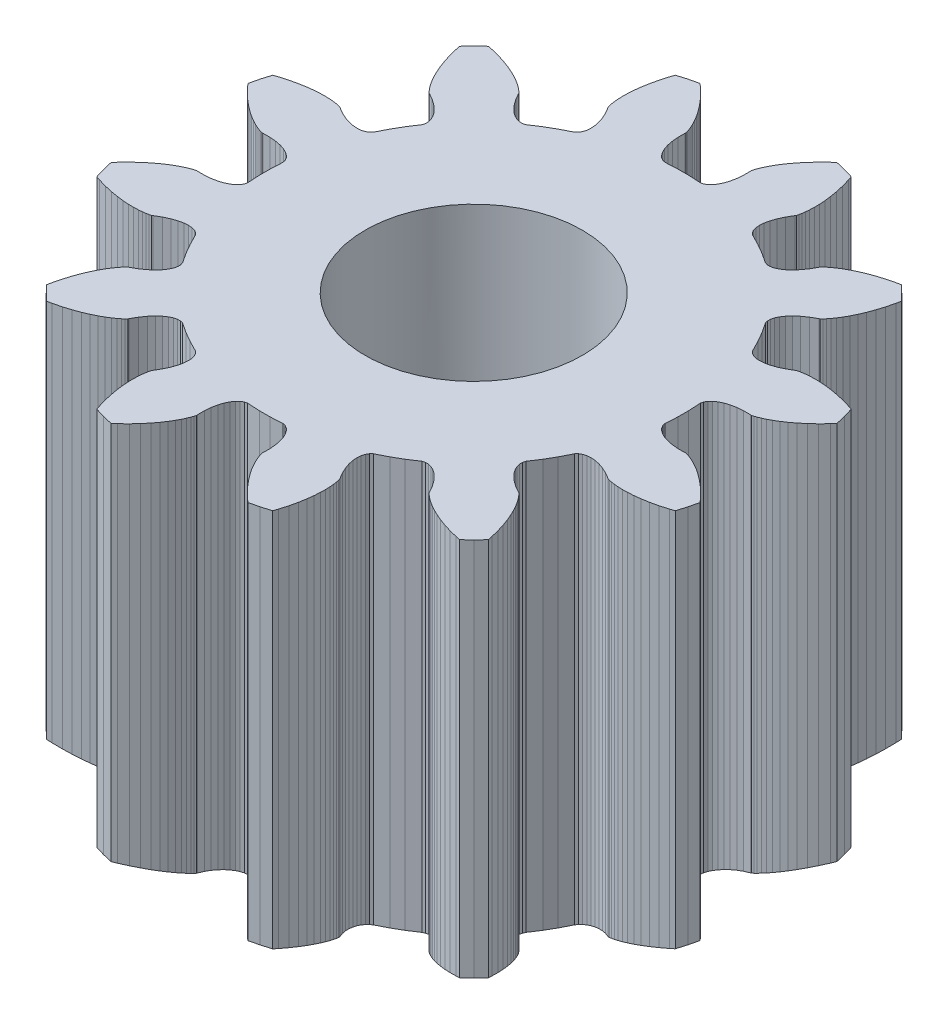
from build123d import *

# Parameters (mm, degrees)
BOSS_EXTRUDE3_DEPTH = 13
SKETCH5_R           = 3.2
CUT_EXTRUDE2_DEPTH  = 18.880490309
BOSS_EXTRUDE4_DEPTH = 6.5


with BuildPart() as part:
    # Sketch4 → Boss-Extrude3 (new body)
    with BuildSketch(Plane(origin=(0, 0, 0), x_dir=(1, 0, 0), z_dir=(0, 1, 0))):
        Polygon((-8.514154269, 2.591520468), (-8.600532227, 2.306770502), (-8.668101704, 2.016980819), (-8.582535159, 1.918957192), (-8.406382101, 1.73729734), (-8.235487485, 1.578593831), (-8.071731561, 1.441761367), (-7.916893513, 1.325582897), (-7.772642932, 1.228717315), (-7.640531833, 1.149707686), (-7.521987223, 1.086989958), (-7.418304279, 1.038902136), (-7.33064013, 1.003693857), (-7.260008302, 0.979536349), (-7.207273811, 0.964532721), (-7.20104707, 0.963108698), (-7.17128186, 0.965774744), (-6.967550359, 0.966777275), (-6.783785979, 0.950125513), (-6.621224107, 0.917931364), (-6.480932873, 0.872384795), (-6.363808518, 0.815742074), (-6.270571529, 0.750313743), (-6.201763575, 0.678452376), (-6.157745236, 0.602540177), (-6.138694542, 0.524976457), (-6.157745236, 0.16146757), (-6.157745236, -0.16146757), (-6.138694542, -0.524976457), (-6.157745236, -0.602540177), (-6.201763575, -0.678452376), (-6.270571529, -0.750313743), (-6.363808518, -0.815742074), (-6.480932873, -0.872384795), (-6.621224107, -0.917931364), (-6.783785979, -0.950125513), (-6.967550359, -0.966777275), (-7.17128186, -0.965774744), (-7.20104707, -0.963108698), (-7.207273811, -0.964532721), (-7.260008302, -0.979536349), (-7.33064013, -1.003693857), (-7.418304279, -1.038902136), (-7.521987223, -1.086989958), (-7.640531833, -1.149707686), (-7.772642932, -1.228717315), (-7.916893513, -1.325582897), (-8.071731561, -1.441761367), (-8.235487485, -1.578593831), (-8.406382101, -1.73729734), (-8.582535159, -1.918957192), (-8.668101704, -2.016980819), (-8.600532227, -2.306770502), (-8.514154269, -2.591520468), (-8.391039654, -2.633628146), (-8.147656705, -2.702873665), (-7.920305872, -2.754867627), (-7.71007285, -2.791490054), (-7.517889931, -2.814684536), (-7.344532473, -2.826447301), (-7.19061609, -2.828816098), (-7.056594583, -2.823858938), (-6.942758608, -2.813662741), (-6.849235089, -2.800321931), (-6.775987377, -2.785927033), (-6.722816154, -2.77255331), (-6.716711627, -2.77067318), (-6.692267222, -2.753481712), (-6.516331832, -2.650747744), (-6.348861329, -2.573286402), (-6.191981544, -2.519886417), (-6.047712487, -2.489185286), (-5.917958459, -2.479677144), (-5.804498693, -2.489721246), (-5.708978573, -2.517551038), (-5.632901474, -2.561283762), (-5.577621229, -2.618930567), (-5.41236517, -2.943263844), (-5.2508976, -3.222933879), (-5.052644772, -3.528216463), (-5.030361297, -3.604913962), (-5.030526197, -3.692665025), (-5.05418495, -3.789302771), (-5.102216385, -3.892583862), (-5.175327692, -4.000200075), (-5.27405018, -4.109790178), (-5.398735816, -4.218952065), (-5.549554557, -4.325255103), (-5.726492478, -4.426252636), (-5.753602929, -4.438826378), (-5.758283433, -4.443172989), (-5.796451028, -4.482533757), (-5.845541232, -4.538770687), (-5.903856472, -4.613094026), (-5.969604625, -4.706580773), (-6.040908404, -4.820168223), (-6.115815158, -4.954648119), (-6.192307034, -5.110661465), (-6.268311482, -5.288693995), (-6.341712041, -5.489072346), (-6.410359365, -5.711960925), (-6.472082461, -5.957359501), (-6.49717345, -6.085033725), (-6.293761725, -6.302214213), (-6.076581237, -6.505625938), (-5.948907013, -6.480534949), (-5.703508437, -6.418811853), (-5.480619858, -6.350164529), (-5.280241507, -6.276763971), (-5.102208976, -6.200759522), (-4.946195631, -6.124267646), (-4.811715735, -6.049360892), (-4.698128285, -5.978057113), (-4.604641537, -5.91230896), (-4.530318199, -5.85399372), (-4.474081269, -5.804903516), (-4.434720501, -5.766735921), (-4.43037389, -5.762055417), (-4.417800148, -5.734944966), (-4.316802615, -5.558007045), (-4.210499577, -5.407188304), (-4.10133769, -5.282502668), (-3.991747587, -5.18378018), (-3.884131374, -5.110668874), (-3.780850283, -5.062637438), (-3.684212536, -5.038978685), (-3.596461474, -5.038813785), (-3.519763975, -5.06109726), (-3.214481391, -5.259350088), (-2.934811356, -5.420817658), (-2.610478079, -5.586073717), (-2.552831274, -5.641353962), (-2.50909855, -5.717431062), (-2.481268758, -5.812951181), (-2.471224656, -5.926410948), (-2.480732798, -6.056164975), (-2.511433929, -6.200434032), (-2.564833914, -6.357313818), (-2.642295256, -6.52478432), (-2.745029224, -6.70071971), (-2.762220692, -6.725164115), (-2.764100822, -6.731268642), (-2.777474545, -6.784439865), (-2.791869443, -6.857687577), (-2.805210253, -6.951211096), (-2.81540645, -7.065047071), (-2.82036361, -7.199068578), (-2.817994813, -7.352984961), (-2.806232048, -7.526342419), (-2.783037566, -7.718525338), (-2.746415139, -7.92875836), (-2.694421177, -8.156109193), (-2.625175658, -8.399492142), (-2.583067979, -8.522606758), (-2.298318014, -8.608984715), (-2.008528331, -8.676554192), (-1.910504704, -8.590987647), (-1.728844851, -8.41483459), (-1.570141343, -8.243939974), (-1.433308879, -8.08018405), (-1.317130409, -7.925346001), (-1.220264827, -7.781095421), (-1.141255197, -7.648984321), (-1.07853747, -7.530439712), (-1.030449648, -7.426756767), (-0.995241369, -7.339092618), (-0.971083861, -7.26846079), (-0.956080233, -7.215726299), (-0.954656209, -7.209499558), (-0.957322255, -7.179734348), (-0.958324787, -6.976002847), (-0.941673025, -6.792238467), (-0.909478876, -6.629676595), (-0.863932307, -6.489385361), (-0.807289586, -6.372261006), (-0.741861255, -6.279024017), (-0.669999888, -6.210216063), (-0.594087689, -6.166197724), (-0.516523969, -6.14714703), (-0.153015082, -6.166197724), (0.169920058, -6.166197724), (0.533428945, -6.14714703), (0.610992665, -6.166197724), (0.686904864, -6.210216063), (0.758766231, -6.279024017), (0.824194562, -6.372261006), (0.880837283, -6.489385361), (0.926383852, -6.629676595), (0.958578002, -6.792238467), (0.975229763, -6.976002847), (0.974227232, -7.179734348), (0.971561186, -7.209499558), (0.972985209, -7.215726299), (0.987988837, -7.26846079), (1.012146345, -7.339092618), (1.047354625, -7.426756767), (1.095442446, -7.530439712), (1.158160174, -7.648984321), (1.237169803, -7.781095421), (1.334035386, -7.925346001), (1.450213855, -8.08018405), (1.587046319, -8.243939974), (1.745749828, -8.41483459), (1.92740968, -8.590987647), (2.025433308, -8.676554192), (2.31522299, -8.608984715), (2.599972956, -8.522606758), (2.642080634, -8.399492142), (2.711326153, -8.156109193), (2.763320115, -7.92875836), (2.799942543, -7.718525338), (2.823137025, -7.526342419), (2.834899789, -7.352984961), (2.837268586, -7.199068578), (2.832311426, -7.065047071), (2.822115229, -6.951211096), (2.80877442, -6.857687577), (2.794379521, -6.784439865), (2.781005798, -6.731268642), (2.779125668, -6.725164115), (2.7619342, -6.70071971), (2.659200232, -6.52478432), (2.58173889, -6.357313818), (2.528338905, -6.200434032), (2.497637774, -6.056164975), (2.488129632, -5.926410948), (2.498173734, -5.812951181), (2.526003526, -5.717431062), (2.56973625, -5.641353962), (2.627383055, -5.586073717), (2.951716332, -5.420817658), (3.231386367, -5.259350088), (3.536668951, -5.06109726), (3.61336645, -5.038813785), (3.701117513, -5.038978685), (3.797755259, -5.062637438), (3.90103635, -5.110668874), (4.008652563, -5.18378018), (4.118242666, -5.282502668), (4.227404553, -5.407188304), (4.333707592, -5.558007045), (4.434705124, -5.734944966), (4.447278866, -5.762055417), (4.451625477, -5.766735921), (4.490986245, -5.804903516), (4.547223175, -5.85399372), (4.621546514, -5.91230896), (4.715033261, -5.978057113), (4.828620711, -6.049360892), (4.963100607, -6.124267646), (5.119113953, -6.200759522), (5.297146483, -6.276763971), (5.497524835, -6.350164529), (5.720413413, -6.418811853), (5.965811989, -6.480534949), (6.093486213, -6.505625938), (6.310666701, -6.302214213), (6.514078426, -6.085033725), (6.488987438, -5.957359501), (6.427264342, -5.711960925), (6.358617017, -5.489072346), (6.285216459, -5.288693995), (6.20921201, -5.110661465), (6.132720134, -4.954648119), (6.057813381, -4.820168223), (5.986509601, -4.706580773), (5.920761448, -4.613094026), (5.862446208, -4.538770687), (5.813356004, -4.482533757), (5.775188409, -4.443172989), (5.770507905, -4.438826378), (5.743397454, -4.426252636), (5.566459533, -4.325255103), (5.415640792, -4.218952065), (5.290955156, -4.109790178), (5.192232669, -4.000200075), (5.119121362, -3.892583862), (5.071089926, -3.789302771), (5.047431173, -3.692665025), (5.047266273, -3.604913962), (5.069549749, -3.528216463), (5.267802577, -3.222933879), (5.429270147, -2.943263844), (5.594526206, -2.618930567), (5.64980645, -2.561283762), (5.72588355, -2.517551038), (5.821403669, -2.489721246), (5.934863436, -2.479677144), (6.064617464, -2.489185286), (6.20888652, -2.519886417), (6.365766306, -2.573286402), (6.533236808, -2.650747744), (6.709172198, -2.753481712), (6.733616603, -2.77067318), (6.73972113, -2.77255331), (6.792892353, -2.785927033), (6.866140065, -2.800321931), (6.959663584, -2.813662741), (7.073499559, -2.823858938), (7.207521066, -2.828816098), (7.361437449, -2.826447301), (7.534794908, -2.814684536), (7.726977826, -2.791490054), (7.937210848, -2.754867627), (8.164561681, -2.702873665), (8.40794463, -2.633628146), (8.531059246, -2.591520468), (8.617437203, -2.306770502), (8.68500668, -2.016980819), (8.599440135, -1.918957192), (8.423287078, -1.73729734), (8.252392462, -1.578593831), (8.088636538, -1.441761367), (7.933798489, -1.325582897), (7.789547909, -1.228717315), (7.657436809, -1.149707686), (7.5388922, -1.086989958), (7.435209255, -1.038902136), (7.347545107, -1.003693857), (7.276913278, -0.979536349), (7.224178787, -0.964532721), (7.217952046, -0.963108698), (7.188186836, -0.965774744), (6.984455335, -0.966777275), (6.800690955, -0.950125513), (6.638129083, -0.917931364), (6.497837849, -0.872384795), (6.380713494, -0.815742074), (6.287476505, -0.750313743), (6.218668551, -0.678452376), (6.174650212, -0.602540177), (6.155599518, -0.524976457), (6.174650212, -0.16146757), (6.174650212, 0.16146757), (6.155599518, 0.524976457), (6.174650212, 0.602540177), (6.218668551, 0.678452376), (6.287476505, 0.750313743), (6.380713494, 0.815742074), (6.497837849, 0.872384795), (6.638129083, 0.917931364), (6.800690955, 0.950125513), (6.984455335, 0.966777275), (7.188186836, 0.965774744), (7.217952046, 0.963108698), (7.224178787, 0.964532721), (7.276913278, 0.979536349), (7.347545107, 1.003693857), (7.435209255, 1.038902136), (7.5388922, 1.086989958), (7.657436809, 1.149707686), (7.789547909, 1.228717315), (7.933798489, 1.325582897), (8.088636538, 1.441761367), (8.252392462, 1.578593831), (8.423287078, 1.73729734), (8.599440135, 1.918957192), (8.68500668, 2.016980819), (8.617437203, 2.306770502), (8.531059246, 2.591520468), (8.40794463, 2.633628146), (8.164561681, 2.702873665), (7.937210848, 2.754867627), (7.726977826, 2.791490054), (7.534794908, 2.814684536), (7.361437449, 2.826447301), (7.207521066, 2.828816098), (7.073499559, 2.823858938), (6.959663584, 2.813662741), (6.866140065, 2.800321931), (6.792892353, 2.785927033), (6.73972113, 2.77255331), (6.733616603, 2.77067318), (6.709172198, 2.753481712), (6.533236808, 2.650747744), (6.365766306, 2.573286402), (6.20888652, 2.519886417), (6.064617464, 2.489185286), (5.934863436, 2.479677144), (5.821403669, 2.489721246), (5.72588355, 2.517551038), (5.64980645, 2.561283762), (5.594526206, 2.618930567), (5.429270147, 2.943263844), (5.267802577, 3.222933879), (5.069549749, 3.528216463), (5.047266273, 3.604913962), (5.047431173, 3.692665025), (5.071089926, 3.789302771), (5.119121362, 3.892583862), (5.192232669, 4.000200075), (5.290955156, 4.109790178), (5.415640792, 4.218952065), (5.566459533, 4.325255103), (5.743397454, 4.426252636), (5.770507905, 4.438826378), (5.775188409, 4.443172989), (5.813356004, 4.482533757), (5.862446208, 4.538770687), (5.920761448, 4.613094026), (5.986509601, 4.706580773), (6.057813381, 4.820168223), (6.132720134, 4.954648119), (6.20921201, 5.110661465), (6.285216459, 5.288693995), (6.358617017, 5.489072346), (6.427264342, 5.711960925), (6.488987438, 5.957359501), (6.514078426, 6.085033725), (6.310666701, 6.302214213), (6.093486213, 6.505625938), (5.965811989, 6.480534949), (5.720413413, 6.418811853), (5.497524835, 6.350164529), (5.297146483, 6.276763971), (5.119113953, 6.200759522), (4.963100607, 6.124267646), (4.828620711, 6.049360892), (4.715033261, 5.978057113), (4.621546514, 5.91230896), (4.547223175, 5.85399372), (4.490986245, 5.804903516), (4.451625477, 5.766735921), (4.447278866, 5.762055417), (4.434705124, 5.734944966), (4.333707592, 5.558007045), (4.227404553, 5.407188304), (4.118242666, 5.282502668), (4.008652563, 5.18378018), (3.90103635, 5.110668874), (3.797755259, 5.062637438), (3.701117513, 5.038978685), (3.61336645, 5.038813785), (3.536668951, 5.06109726), (3.231386367, 5.259350088), (2.951716332, 5.420817658), (2.627383055, 5.586073717), (2.56973625, 5.641353962), (2.526003526, 5.717431062), (2.498173734, 5.812951181), (2.488129632, 5.926410948), (2.497637774, 6.056164975), (2.528338905, 6.200434032), (2.58173889, 6.357313818), (2.659200232, 6.52478432), (2.7619342, 6.70071971), (2.779125668, 6.725164115), (2.781005798, 6.731268642), (2.794379521, 6.784439865), (2.80877442, 6.857687577), (2.822115229, 6.951211096), (2.832311426, 7.065047071), (2.837268586, 7.199068578), (2.834899789, 7.352984961), (2.823137025, 7.526342419), (2.799942543, 7.718525338), (2.763320115, 7.92875836), (2.711326153, 8.156109193), (2.642080634, 8.399492142), (2.599972956, 8.522606758), (2.31522299, 8.608984715), (2.025433308, 8.676554192), (1.92740968, 8.590987647), (1.745749828, 8.41483459), (1.587046319, 8.243939974), (1.450213855, 8.08018405), (1.334035386, 7.925346001), (1.237169803, 7.781095421), (1.158160174, 7.648984321), (1.095442446, 7.530439712), (1.047354625, 7.426756767), (1.012146345, 7.339092618), (0.987988837, 7.26846079), (0.972985209, 7.215726299), (0.971561186, 7.209499558), (0.974227232, 7.179734348), (0.975229763, 6.976002847), (0.958578002, 6.792238467), (0.926383852, 6.629676595), (0.880837283, 6.489385361), (0.824194562, 6.372261006), (0.758766231, 6.279024017), (0.686904864, 6.210216063), (0.610992665, 6.166197724), (0.533428945, 6.14714703), (0.169920058, 6.166197724), (-0.153015082, 6.166197724), (-0.516523969, 6.14714703), (-0.594087689, 6.166197724), (-0.669999888, 6.210216063), (-0.741861255, 6.279024017), (-0.807289586, 6.372261006), (-0.863932307, 6.489385361), (-0.909478876, 6.629676595), (-0.941673025, 6.792238467), (-0.958324787, 6.976002847), (-0.957322255, 7.179734348), (-0.954656209, 7.209499558), (-0.956080233, 7.215726299), (-0.971083861, 7.26846079), (-0.995241369, 7.339092618), (-1.030449648, 7.426756767), (-1.07853747, 7.530439712), (-1.141255197, 7.648984321), (-1.220264827, 7.781095421), (-1.317130409, 7.925346001), (-1.433308879, 8.08018405), (-1.570141343, 8.243939974), (-1.728844851, 8.41483459), (-1.910504704, 8.590987647), (-2.008528331, 8.676554192), (-2.298318014, 8.608984715), (-2.583067979, 8.522606758), (-2.625175658, 8.399492142), (-2.694421177, 8.156109193), (-2.746415139, 7.92875836), (-2.783037566, 7.718525338), (-2.806232048, 7.526342419), (-2.817994813, 7.352984961), (-2.82036361, 7.199068578), (-2.81540645, 7.065047071), (-2.805210253, 6.951211096), (-2.791869443, 6.857687577), (-2.777474545, 6.784439865), (-2.764100822, 6.731268642), (-2.762220692, 6.725164115), (-2.745029224, 6.70071971), (-2.642295256, 6.52478432), (-2.564833914, 6.357313818), (-2.511433929, 6.200434032), (-2.480732798, 6.056164975), (-2.471224656, 5.926410948), (-2.481268758, 5.812951181), (-2.50909855, 5.717431062), (-2.552831274, 5.641353962), (-2.610478079, 5.586073717), (-2.934811356, 5.420817658), (-3.214481391, 5.259350088), (-3.519763975, 5.06109726), (-3.596461474, 5.038813785), (-3.684212536, 5.038978685), (-3.780850282, 5.062637438), (-3.884131374, 5.110668874), (-3.991747587, 5.18378018), (-4.10133769, 5.282502668), (-4.210499577, 5.407188304), (-4.316802615, 5.558007045), (-4.417800148, 5.734944966), (-4.43037389, 5.762055417), (-4.434720501, 5.766735921), (-4.474081269, 5.804903516), (-4.530318199, 5.85399372), (-4.604641537, 5.91230896), (-4.698128285, 5.978057113), (-4.811715735, 6.049360892), (-4.946195631, 6.124267646), (-5.102208976, 6.200759522), (-5.280241507, 6.276763971), (-5.480619858, 6.350164529), (-5.703508437, 6.418811853), (-5.948907013, 6.480534949), (-6.076581237, 6.505625938), (-6.293761725, 6.302214213), (-6.49717345, 6.085033725), (-6.472082461, 5.957359501), (-6.410359365, 5.711960925), (-6.341712041, 5.489072346), (-6.268311482, 5.288693995), (-6.192307034, 5.110661465), (-6.115815158, 4.954648119), (-6.040908404, 4.820168223), (-5.969604625, 4.706580773), (-5.903856472, 4.613094026), (-5.845541232, 4.538770687), (-5.796451028, 4.482533757), (-5.758283433, 4.443172989), (-5.753602929, 4.438826378), (-5.726492478, 4.426252636), (-5.549554557, 4.325255103), (-5.398735816, 4.218952065), (-5.27405018, 4.109790178), (-5.175327692, 4.000200075), (-5.102216385, 3.892583862), (-5.05418495, 3.789302771), (-5.030526197, 3.692665025), (-5.030361297, 3.604913962), (-5.052644772, 3.528216463), (-5.2508976, 3.222933879), (-5.41236517, 2.943263844), (-5.577621229, 2.618930567), (-5.632901474, 2.561283762), (-5.708978573, 2.517551038), (-5.804498693, 2.489721246), (-5.917958459, 2.479677144), (-6.047712487, 2.489185286), (-6.191981544, 2.519886417), (-6.348861329, 2.573286402), (-6.516331832, 2.650747744), (-6.692267222, 2.753481712), (-6.716711627, 2.77067318), (-6.722816154, 2.77255331), (-6.775987377, 2.785927033), (-6.849235089, 2.800321931), (-6.942758608, 2.813662741), (-7.056594583, 2.823858938), (-7.19061609, 2.828816098), (-7.344532473, 2.826447301), (-7.517889931, 2.814684536), (-7.71007285, 2.791490054), (-7.920305872, 2.754867627), (-8.147656705, 2.702873665), (-8.391039654, 2.633628146), align=None)
    extrude(amount=BOSS_EXTRUDE3_DEPTH)

    # Sketch5 → Cut-Extrude2 (cut, through all)
    with BuildSketch(Plane.XZ):
        Circle(SKETCH5_R)
    extrude(amount=-CUT_EXTRUDE2_DEPTH, mode=Mode.SUBTRACT)

    # Sketch5<3> → Boss-Extrude4 (add)
    with BuildSketch(Plane.XZ):
        with BuildLine():
            ThreePointArc((2.25, -2.275412051), (3.2, 0), (2.25, 2.275412051))
            Line((2.25, 2.275412051), (2.25, -2.275412051))
        make_face()
        with BuildLine():
            Line((-2.25, -2.275412051), (-2.25, 2.275412051))
            ThreePointArc((-2.25, 2.275412051), (-3.2, 0), (-2.25, -2.275412051))
        make_face()
    extrude(amount=-BOSS_EXTRUDE4_DEPTH)

    # Sketch6 → Cut-Revolve1 (revolve, cut)
    with BuildSketch(Plane.XY):
        Polygon((3, 0), (9.5, 0), (9.5, 2), align=None)
    revolve(axis=Axis((0, 0, 0), (0, 1, 0)), mode=Mode.SUBTRACT)


solid = part.part
